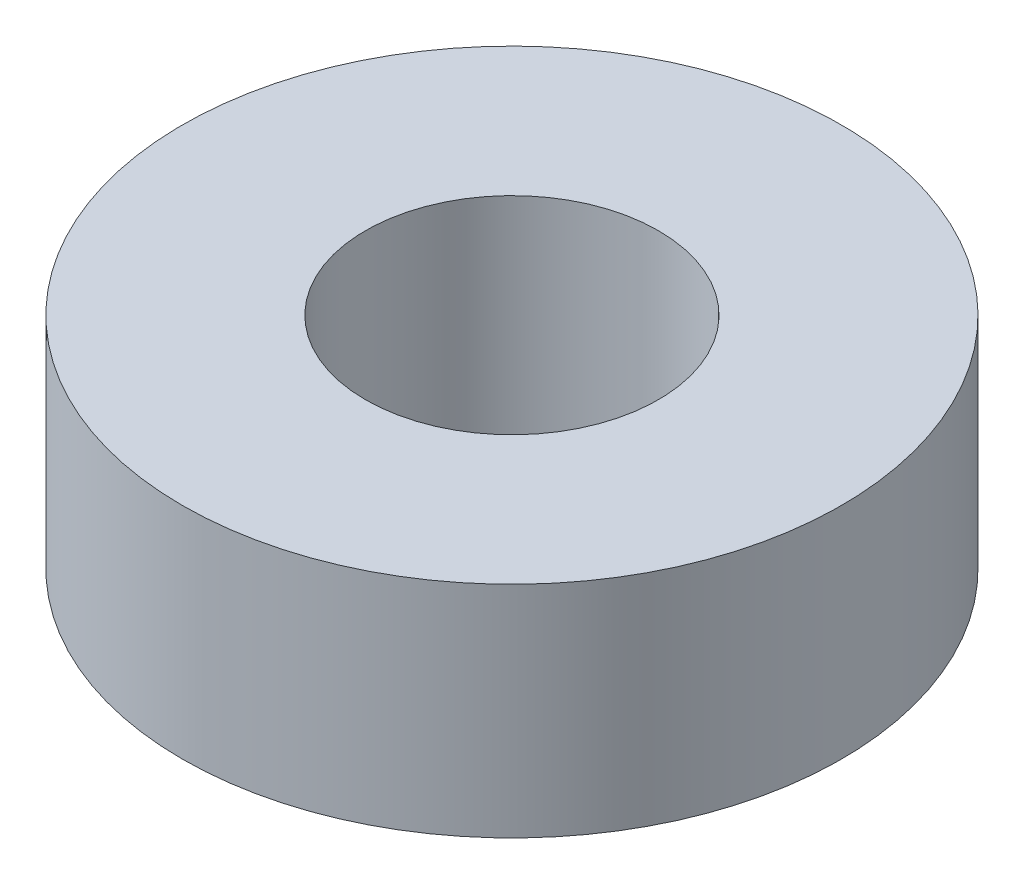
from build123d import *

# Parameters (mm, degrees)
SKETCH1_R           = 22.5
BOSS_EXTRUDE1_DEPTH = 15
SKETCH2_R           = 10
CUT_EXTRUDE1_DEPTH  = 36.178118199


with BuildPart() as part:
    # Sketch1 → Boss-Extrude1 (new body)
    with BuildSketch(Plane(origin=(0, 0, 0), x_dir=(1, 0, 0), z_dir=(0, 1, 0))):
        Circle(SKETCH1_R)
    extrude(amount=BOSS_EXTRUDE1_DEPTH)

    # Sketch2 → Cut-Extrude1 (cut, through all)
    with BuildSketch(Plane(origin=(0, 0, 0), x_dir=(1, 0, 0), z_dir=(0, 1, 0))):
        Circle(SKETCH2_R)
    extrude(amount=CUT_EXTRUDE1_DEPTH, mode=Mode.SUBTRACT)


solid = part.part
